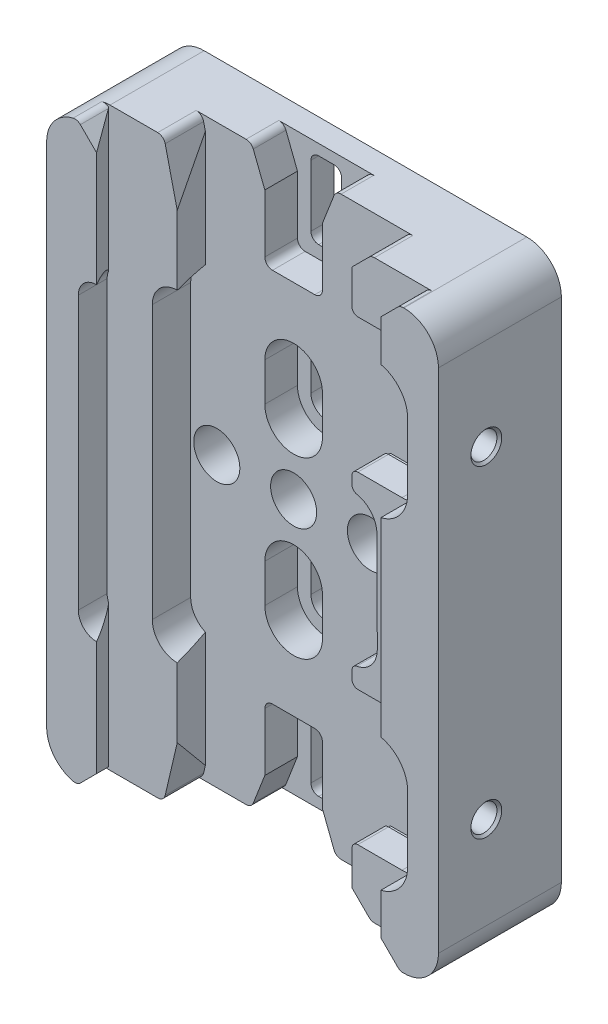
from build123d import *

# Parameters (mm, degrees)
SKETCH_1_W                   = 102
SKETCH_1_H                   = 150
EXTRUDE_1_DEPTH              = 32
SKETCH_2_W                   = 45.5
SKETCH_2_H                   = 10
CUT_EXTRUDE_1_DEPTH          = 162.632298752
SKETCH_3_R                   = 3.3
CUT_EXTRUDE_2_DEPTH          = 93.370179171
SKETCH_4_R                   = 6
CUT_EXTRUDE_3_DEPTH          = 8.5
CUT_EXTRUDE_4_DEPTH          = 10
CUT_EXTRUDE_5_DEPTH          = 10
CUT_EXTRUDE_6_DEPTH          = 30
CUT_EXTRUDE_7_REACH          = 110.78
SKETCH_8_W                   = 2
SKETCH_8_H                   = 38
FILLET_1_R                   = 9
HOLE_WIZARD_M8_1_D           = 6.8
HOLE_WIZARD_M8_1_DEPTH       = 19.75
HOLE_WIZARD_M8_1_CSINK_D     = 8.05
HOLE_WIZARD_M8_1_CSINK_ANGLE = 90
HOLE_WIZARD_M8_1_TIP         = 2.042926105
FILLET_2_R                   = 9
CUT_EXTRUDE_8_DEPTH          = 10
CUT_EXTRUDE_9_DEPTH          = 7.5
FILLET_3_R                   = 2
CUT_EXTRUDE_10_DEPTH         = 8.5
FILLET_4_R                   = 2
FILLET_5_R                   = 1.5


with BuildPart() as part:
    # 草图1 → 凸台-拉伸1 (new body)
    with BuildSketch(Plane.XY):
        Rectangle(SKETCH_1_W, SKETCH_1_H)
    extrude(amount=EXTRUDE_1_DEPTH)

    # 草图2 → 切除-拉伸1 (cut, through all)
    with BuildSketch(Plane.XZ.offset(75)):
        Polygon((-38, 32), (-42.330127019, 24.5), (-38, 24.5), align=None)
        Polygon((-24.5, 24.5), (21, 24.5), (36, 24.5), (36, 32), (-38, 32), (-38, 24.5), align=None)
        with Locations((-1.75, 19.5)):
            Rectangle(SKETCH_2_W, SKETCH_2_H)
        Polygon((-24.5, 24.5), (-27.179491924, 14.5), (-24.5, 14.5), align=None)
    extrude(amount=-CUT_EXTRUDE_1_DEPTH, mode=Mode.SUBTRACT)

    # 草图3 → 切除-拉伸2 (cut, through all)
    with BuildSketch(Plane.XY.offset(14.5)):
        with Locations((-4.2, 0)):
            Circle(SKETCH_3_R)
        with Locations((15.8, 0)):
            Circle(SKETCH_3_R)
        with Locations(Location((-24.2, 0, 0), (0, 0, 154.538763547))):
            Circle(SKETCH_3_R)
        with BuildLine():
            Line((-8.2, 17.7), (-8.2, 27.7))
            ThreePointArc((-8.2, 27.7), (-4.2, 31.7), (-0.2, 27.7))
            Line((-0.2, 27.7), (-0.2, 17.7))
            ThreePointArc((-0.2, 17.7), (-4.2, 13.7), (-8.2, 17.7))
        make_face()
        with BuildLine():
            Line((-6.2, 52.2), (-2.2, 52.2))
            ThreePointArc((-2.2, 52.2), (-0.785786438, 52.785786438), (-0.2, 54.2))
            Line((-0.2, 54.2), (-0.2, 70.2))
            ThreePointArc((-0.2, 70.2), (-0.785786438, 71.614213562), (-2.2, 72.2))
            Line((-2.2, 72.2), (-6.2, 72.2))
            ThreePointArc((-6.2, 72.2), (-7.614213562, 71.614213562), (-8.2, 70.2))
            Line((-8.2, 70.2), (-8.2, 54.2))
            ThreePointArc((-8.2, 54.2), (-7.614213562, 52.785786438), (-6.2, 52.2))
        make_face()
        with BuildLine():
            Line((-8.2, -17.7), (-8.2, -27.7))
            ThreePointArc((-8.2, -27.7), (-4.2, -31.7), (-0.2, -27.7))
            Line((-0.2, -27.7), (-0.2, -17.7))
            ThreePointArc((-0.2, -17.7), (-4.2, -13.7), (-8.2, -17.7))
        make_face()
        with BuildLine():
            Line((-0.2, -54.2), (-0.2, -70.2))
            ThreePointArc((-0.2, -70.2), (-0.785786438, -71.614213562), (-2.2, -72.2))
            Line((-2.2, -72.2), (-6.2, -72.2))
            ThreePointArc((-6.2, -72.2), (-7.614213562, -71.614213562), (-8.2, -70.2))
            Line((-8.2, -70.2), (-8.2, -54.2))
            ThreePointArc((-8.2, -54.2), (-7.614213562, -52.785786438), (-6.2, -52.2))
            Line((-6.2, -52.2), (-2.2, -52.2))
            ThreePointArc((-2.2, -52.2), (-0.785786438, -52.785786438), (-0.2, -54.2))
        make_face()
    extrude(amount=-CUT_EXTRUDE_2_DEPTH, mode=Mode.SUBTRACT)

    # 草图4 → 切除-拉伸3 (cut)
    with BuildSketch(Plane.XY.offset(14.5)):
        with Locations((15.8, 0)):
            Circle(SKETCH_4_R)
        with Locations((-4.2, 0)):
            Circle(SKETCH_4_R)
        with Locations((-24.2, 0)):
            Circle(SKETCH_4_R)
    extrude(amount=-CUT_EXTRUDE_3_DEPTH, mode=Mode.SUBTRACT)

    # 草图5 → 切除-拉伸4 (cut)
    with BuildSketch(Plane.XY.offset(14.5)):
        with BuildLine():
            Line((-31, -35.5), (-31, 35.5))
            ThreePointArc((-31, 35.5), (-24.5, 42), (-18, 35.5))
            Line((-18, 35.5), (-18, -35.5))
            ThreePointArc((-18, -35.5), (-24.5, -42), (-31, -35.5))
        make_face()
        with BuildLine():
            Line((14.581542708, -13.020313807), (14.500031942, 12.979558424))
            ThreePointArc((14.500031942, 12.979558424), (20.979622309, 19.499904173), (27.499968058, 13.020313807))
            Line((27.499968058, 13.020313807), (27.581478823, -12.979558424))
            ThreePointArc((27.581478823, -12.979558424), (21.101888457, -19.499904173), (14.581542708, -13.020313807))
        make_face()
    extrude(amount=CUT_EXTRUDE_4_DEPTH, mode=Mode.SUBTRACT)

    # 草图6 → 切除-拉伸5 (cut)
    with BuildSketch(Plane.XY.offset(24.5)):
        with BuildLine():
            Line((-42.75, -35.5), (-42.75, 35.5))
            ThreePointArc((-42.75, 35.5), (-38, 40.25), (-33.25, 35.5))
            Line((-33.25, 35.5), (-33.25, -35.5))
            ThreePointArc((-33.25, -35.5), (-38, -40.25), (-42.75, -35.5))
        make_face()
    extrude(amount=CUT_EXTRUDE_5_DEPTH, mode=Mode.SUBTRACT)

    # 草图7 → 切除-拉伸6 (cut)
    with BuildSketch(Plane.XY.offset(14.5)):
        with BuildLine():
            Line((21, 59.5), (34, 59.5))
            ThreePointArc((34, 59.5), (40.363961031, 56.863961031), (43, 50.5))
            Line((43, 50.5), (43, 33.5))
            ThreePointArc((43, 33.5), (40.363961031, 27.136038969), (34, 24.5))
            Line((34, 24.5), (21, 24.5))
            Line((21, 24.5), (21, 59.5))
        make_face()
        with BuildLine():
            Line((21, -59.5), (34, -59.5))
            ThreePointArc((34, -59.5), (40.363961031, -56.863961031), (43, -50.5))
            Line((43, -50.5), (43, -33.5))
            ThreePointArc((43, -33.5), (40.363961031, -27.136038969), (34, -24.5))
            Line((34, -24.5), (21, -24.5))
            Line((21, -24.5), (21, -59.5))
        make_face()
    extrude(amount=CUT_EXTRUDE_6_DEPTH, mode=Mode.SUBTRACT)

    # 切除-拉伸7: up to this face of the body (flat: up to its plane)
    cut_extrude_7_end = Plane(part.part.faces().sort_by_distance((43, -42, 23.25))[0])
    # 草图8 → 切除-拉伸7 (cut, up to the picked face)
    with BuildSketch(Plane.ZY.offset(-21), mode=Mode.PRIVATE) as cut_extrude_7_sk1:
        with Locations((15.5, -42)):
            Rectangle(SKETCH_8_W, SKETCH_8_H)
    cut_extrude_7_tool1 = split(extrude(cut_extrude_7_sk1.sketch, amount=-CUT_EXTRUDE_7_REACH, mode=Mode.PRIVATE), bisect_by=cut_extrude_7_end, keep=Keep.BOTH, mode=Mode.PRIVATE)
    # 草图8 → 切除-拉伸7 (cut, up to the picked face)
    with BuildSketch(Plane.ZY.offset(-21), mode=Mode.PRIVATE) as cut_extrude_7_sk2:
        with Locations((15.5, 42)):
            Rectangle(SKETCH_8_W, SKETCH_8_H)
    cut_extrude_7_tool2 = split(extrude(cut_extrude_7_sk2.sketch, amount=-CUT_EXTRUDE_7_REACH, mode=Mode.PRIVATE), bisect_by=cut_extrude_7_end, keep=Keep.BOTH, mode=Mode.PRIVATE)
    add(cut_extrude_7_tool1.solids().sort_by(Axis((21, -42, 15.5), (1, 0, 0)))[0], mode=Mode.SUBTRACT)
    add(cut_extrude_7_tool2.solids().sort_by(Axis((21, 42, 15.5), (1, 0, 0)))[0], mode=Mode.SUBTRACT)

    # 圆角1
    fillet_1_edges = [part.edges().sort_by_distance(p)[0] for p in [
        (43, -61, 15.5),
        (43, -23, 15.5),
        (43, 23, 15.5),
        (43, 61, 15.5),
    ]]
    fillet(fillet_1_edges, radius=FILLET_1_R)

    # M8 螺纹孔1
    with Locations(Plane(origin=(51, 0, 0), x_dir=(0, 0, -1), z_dir=(1, 0, 0))):
        with Locations((-19.55, 42), (-19.55, -42)):
            CounterSinkHole(HOLE_WIZARD_M8_1_D / 2, HOLE_WIZARD_M8_1_CSINK_D / 2, depth=HOLE_WIZARD_M8_1_DEPTH, counter_sink_angle=HOLE_WIZARD_M8_1_CSINK_ANGLE)
            with Locations((0, 0, -(HOLE_WIZARD_M8_1_DEPTH + HOLE_WIZARD_M8_1_TIP / 2))):  # 118° drill point
                Cone(0, HOLE_WIZARD_M8_1_D / 2, HOLE_WIZARD_M8_1_TIP, mode=Mode.SUBTRACT)

    # 圆角2
    # the kernel refuses this fillet: 9 mm, written as the material it takes off along each edge
    with BuildSketch(Plane(origin=(51, -75, -22.5), x_dir=(0, 1, 0), z_dir=(0, 0, 1)), Plane(origin=(-51, 75, -22.5), x_dir=(0, -1, 0), z_dir=(0, 0, 1))) as fillet_2_piece_1:
        with BuildLine():
            CenterArc((FILLET_2_R, FILLET_2_R), FILLET_2_R, 180, 90)
            Line((0, FILLET_2_R), (0, 0))
            Line((0, 0), (FILLET_2_R, 0))
        make_face()
    extrude(amount=77, mode=Mode.SUBTRACT)
    with BuildSketch(Plane(origin=(-51, -75, -22.5), x_dir=(0, 1, 0), z_dir=(0, 0, 1)), Plane(origin=(51, 75, -22.5), x_dir=(0, -1, 0), z_dir=(0, 0, 1))) as fillet_2_piece_2:
        with BuildLine():
            CenterArc((FILLET_2_R, -FILLET_2_R), FILLET_2_R, 90, 90)
            Line((0, -FILLET_2_R), (0, 0))
            Line((0, 0), (FILLET_2_R, 0))
        make_face()
    extrude(amount=77, mode=Mode.SUBTRACT)

    # 草图11 → 切除-拉伸8 (cut)
    with BuildSketch(Plane.XY.offset(24.5)):
        Polygon((-24.5, 60), (-24.5, 75), (-28, 75), align=None)
        Polygon((-28, -75), (-24.5, -60), (-24.5, -75), align=None)
        Polygon((21, 70), (21, 75), (26, 75), align=None)
        Polygon((26, -75), (21, -70), (21, -75), align=None)
    extrude(amount=-CUT_EXTRUDE_8_DEPTH, mode=Mode.SUBTRACT)

    # 草图12 → 切除-拉伸9 (cut)
    with BuildSketch(Plane.XY.offset(24.5)):
        Polygon((41, -75), (36, -75), (36, -70), align=None)
        Polygon((-38, -70), (-43, -75), (-38, -75), align=None)
        Polygon((36, 70), (41, 75), (36, 75), align=None)
        Polygon((-43, 75), (-38, 75), (-38, 70), align=None)
    extrude(amount=CUT_EXTRUDE_9_DEPTH, mode=Mode.SUBTRACT)

    # 圆角3
    # the kernel refuses this fillet: 2 mm, written as the material it takes off along each edge
    with BuildSketch(Plane(origin=(-28, 75, 28.4676406), x_dir=(0.22722961560733482, -0.9738412097415794, -2.863869813921773e-13), z_dir=(-1.26034179403388e-12, 0, -1.0)), Plane(origin=(-28, -75, 28.4676406), x_dir=(-1.0, 0, 1.26034179403388e-12), z_dir=(-1.26034179403388e-12, 0, -1.0))) as fillet_3_piece_1:
        with BuildLine():
            CenterArc((FILLET_3_R * 0.793528120049, FILLET_3_R), FILLET_3_R, 193.134022306, 76.865977694)
            Line((-FILLET_3_R * 0.180313089692, FILLET_3_R * 0.772770384393), (0, 0))
            Line((0, 0), (FILLET_3_R * 0.793528120049, 0))
        make_face()
    extrude(amount=13.9676406, mode=Mode.SUBTRACT)
    with BuildSketch(Plane(origin=(-42.949747468, 74.949747468, 34.922976922), x_dir=(-0.9854618251974762, -0.16989700138159822, 0), z_dir=(0, 0, -1))) as fillet_3_piece_2:
        with BuildLine():
            CenterArc((1.039280683, -1.995776383), FILLET_3_R, 86.275728175, 58.50610238)
            Line((-0.594643439, -0.842393548), (0, 0))
            ThreePointArc((0, 0), (0.584595384, 0.019006278), (1.169190769, 0))
        make_face()
    extrude(amount=10.422976922, mode=Mode.SUBTRACT)
    with BuildSketch(Plane(origin=(26, 75, 26.571067812), x_dir=(1.0, 0, -1.2603417940338797e-12), z_dir=(-1.26034179403388e-12, 0, -1.0))) as fillet_3_piece_3:
        with BuildLine():
            CenterArc((FILLET_3_R * 0.414213562375, FILLET_3_R), FILLET_3_R, 225, 45)
            Line((-FILLET_3_R * 0.292893218814, FILLET_3_R * 0.292893218816), (0, 0))
            Line((0, 0), (FILLET_3_R * 0.414213562375, 0))
        make_face()
    extrude(amount=12.071067812, mode=Mode.SUBTRACT)
    with BuildSketch(Plane(origin=(41, 75, 24.5), x_dir=(1.0, 6.861607637275384e-12, 0), z_dir=(0, 0, 1)), Plane(origin=(41, -75, 24.5), x_dir=(-0.7071067811865475, 0.7071067811865475, 0), z_dir=(0, 0, 1))) as fillet_3_piece_4:
        with BuildLine():
            CenterArc((FILLET_3_R * 0.414213562366, -FILLET_3_R), FILLET_3_R, 90, 45)
            Line((-FILLET_3_R * 0.292893218817, -FILLET_3_R * 0.29289321881), (0, 0))
            Line((0, 0), (FILLET_3_R * 0.414213562373, 0))
        make_face()
    extrude(amount=9.571067812, mode=Mode.SUBTRACT)
    with BuildSketch(Plane(origin=(-42.949747468, -74.949747468, 34.922976922), x_dir=(0.7071067811865509, 0.707106781186544, 0), z_dir=(0, 0, -1))) as fillet_3_piece_5:
        with BuildLine():
            CenterArc((1.031129336, -2), FILLET_3_R, 90, 58.50610238)
            ThreePointArc((-0.674262282, -0.9551845), (-0.352658549, -0.466631493), (0, 0))
            Line((0, 0), (1.031129336, 0))
        make_face()
    extrude(amount=10.422976922, mode=Mode.SUBTRACT)
    with BuildSketch(Plane(origin=(26, -75, 26.571067812), x_dir=(1.0, 0, -1.26034179403388e-12), z_dir=(-1.26034179403388e-12, 0, -1.0))) as fillet_3_piece_6:
        with BuildLine():
            CenterArc((FILLET_3_R * 0.414213562375, -FILLET_3_R), FILLET_3_R, 90, 45)
            Line((-FILLET_3_R * 0.292893218814, -FILLET_3_R * 0.292893218816), (0, 0))
            Line((0, 0), (FILLET_3_R * 0.414213562375, 0))
        make_face()
    extrude(amount=12.071067812, mode=Mode.SUBTRACT)

    # 草图13 → 切除-拉伸10 (cut)
    with BuildSketch(Plane.XY.offset(14.5)):
        with BuildLine():
            Line((3.3, -17.7), (3.3, -27.7))
            ThreePointArc((3.3, -27.7), (-4.2, -35.2), (-11.7, -27.7))
            Line((-11.7, -27.7), (-11.7, -17.7))
            ThreePointArc((-11.7, -17.7), (-4.2, -10.2), (3.3, -17.7))
        make_face()
        with BuildLine():
            Line((3.3, 27.7), (3.3, 17.7))
            ThreePointArc((3.3, 17.7), (-4.2, 10.2), (-11.7, 17.7))
            Line((-11.7, 17.7), (-11.7, 27.7))
            ThreePointArc((-11.7, 27.7), (-4.2, 35.2), (3.3, 27.7))
        make_face()
        Polygon((-11.7, 66), (-11.7, 48.9), (3.3, 48.9), (3.3, 66), (6.8, 75), (-15.2, 75), align=None)
        Polygon((6.8, -75), (3.3, -66), (3.3, -48.9), (-11.7, -48.9), (-11.7, -66), (-15.2, -75), align=None)
    extrude(amount=-CUT_EXTRUDE_10_DEPTH, mode=Mode.SUBTRACT)

    # 圆角4
    fillet_4_edges = [part.edges().sort_by_distance(p)[0] for p in [
        (-11.7, -48.9, 10.25),
        (3.3, -48.9, 10.25),
        (6.8, -75, 10.25),
        (-15.2, -75, 10.25),
        (3.3, 48.9, 10.25),
        (-11.7, 48.9, 10.25),
        (-15.2, 75, 10.25),
        (6.8, 75, 10.25),
    ]]
    fillet(fillet_4_edges, radius=FILLET_4_R)

    # 圆角5
    fillet_5_edges = [part.edges().sort_by_distance(p)[0] for p in [
        (21, -59.5, 20.5),
        (21, -24.5, 20.5),
        (21, -19.499425018, 19.5),
        (21, 19.499936115, 19.5),
        (21, 24.5, 20.5),
        (21, 59.5, 20.5),
    ]]
    fillet(fillet_5_edges, radius=FILLET_5_R)


solid = part.part
